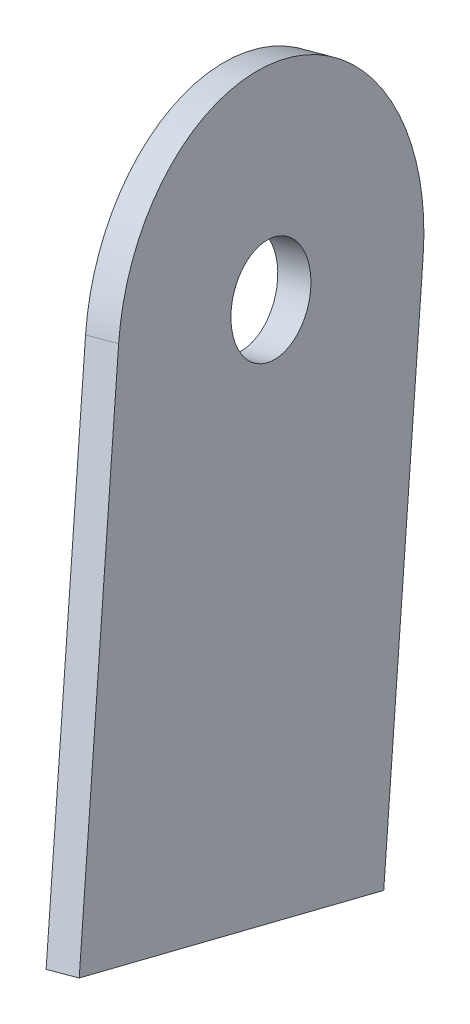
from build123d import *

# Parameters (mm, degrees)
SKETCH1_R           = 2.4892
BOSS_EXTRUDE1_DEPTH = 1.5875


with BuildPart() as part:
    # Sketch1 → Boss-Extrude1 (new body)
    with BuildSketch(Plane(origin=(434.727575408, 72.51478686, -64.236034376), x_dir=(-0.14225854855862918, -0.023729454746585155, -0.9895450562452536), z_dir=(0.9760593070661705, 0.1628116931578593, -0.14422406754969186))):
        with BuildLine():
            Line((378.313779683, 214.312015211), (371.153572026, 190.318168739))
            Line((371.153572026, 190.318168739), (389.40808928, 184.870683095))
            Line((389.40808928, 184.870683095), (396.568296936, 208.864529566))
            ThreePointArc((396.568296936, 208.864529566), (390.164781132, 220.715531015), (378.313779683, 214.312015211))
        make_face()
        with Locations((387.441038309, 211.588272388)):
            Circle(SKETCH1_R, mode=Mode.SUBTRACT)
    extrude(amount=BOSS_EXTRUDE1_DEPTH)


solid = part.part
